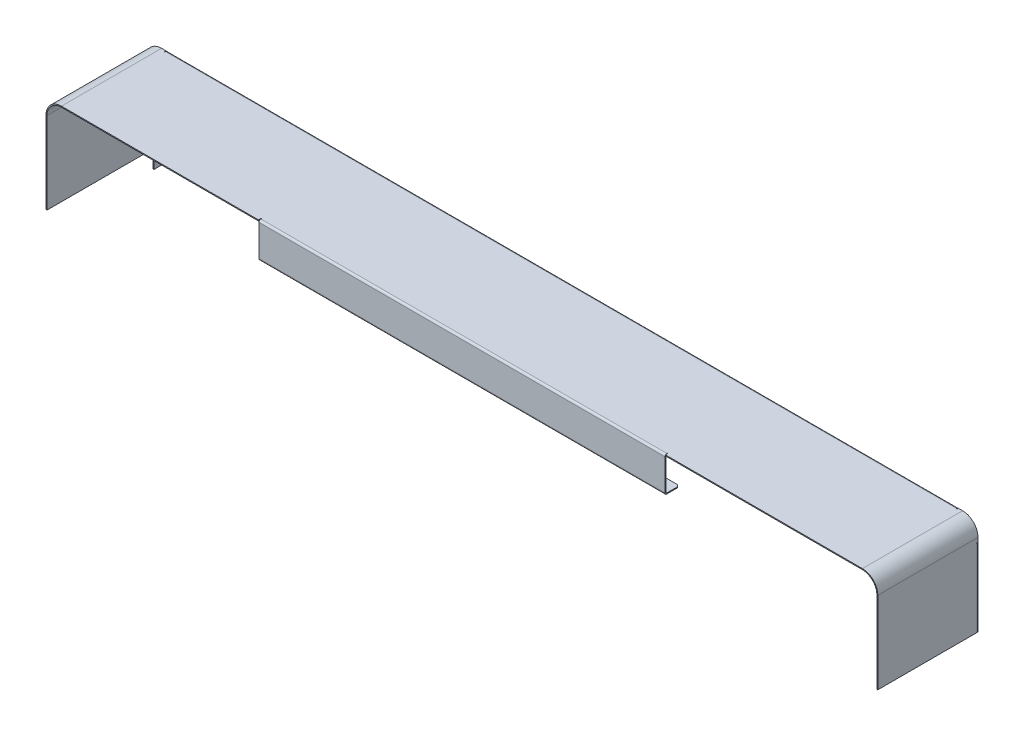
from build123d import *

# Parameters (mm, degrees)
BASE_FLANGE1_DEPTH             = 104
EDGE_FLANGE1_STRIP_W           = 6
EDGE_FLANGE1_STRIP_H           = 1
EDGE_FLANGE1_STRIP_CUT_DEPTH   = 821.4
EDGE_FLANGE1_RELIEF_W          = 6.5
EDGE_FLANGE1_RELIEF_H          = 0.5
EDGE_FLANGE1_RELIEF_CUT_DEPTH  = 1
EDGE_FLANGE1_DEPTH             = 821.4
EDGE_FLANGE2_STRIP_W           = 6
EDGE_FLANGE2_STRIP_H           = 1
EDGE_FLANGE2_STRIP_CUT_DEPTH   = 821.4
EDGE_FLANGE2_DEPTH             = 821.4
EDGE_FLANGE3_STRIP_W           = 6
EDGE_FLANGE3_STRIP_H           = 1
EDGE_FLANGE3_STRIP_CUT_DEPTH   = 80
EDGE_FLANGE3_RELIEF_W          = 6.5
EDGE_FLANGE3_RELIEF_H          = 0.5
EDGE_FLANGE3_RELIEF_CUT_DEPTH  = 1
EDGE_FLANGE3_DEPTH             = 80
EDGE_FLANGE4_STRIP_W           = 6
EDGE_FLANGE4_STRIP_H           = 1
EDGE_FLANGE4_STRIP_CUT_DEPTH   = 80
EDGE_FLANGE4_DEPTH             = 80
EDGE_FLANGE5_STRIP_W           = 6
EDGE_FLANGE5_STRIP_H           = 1
EDGE_FLANGE5_STRIP_CUT_DEPTH   = 421.4
EDGE_FLANGE5_RELIEF_W          = 6.5
EDGE_FLANGE5_RELIEF_H          = 0.5
EDGE_FLANGE5_RELIEF_CUT_DEPTH  = 1
EDGE_FLANGE5_DEPTH             = 421.4
SKETCH22_R                     = 2.5
CUT_EXTRUDE1_DEPTH             = 1
SKETCH23_R                     = 2.5
CUT_EXTRUDE2_DEPTH             = 3
CUT_EXTRUDE2_DIRECTION_2_REACH = 857.652
EDGE_FLANGE6_STRIP_W           = 6
EDGE_FLANGE6_STRIP_H           = 1
EDGE_FLANGE6_STRIP_CUT_DEPTH   = 421.4
EDGE_FLANGE6_DEPTH             = 421.4
EDGE_FLANGE6_FLAT_DEPTH        = 1


# Sheet-metal steps are written as plain solids
with BuildPart() as part:
    # Sketch1 → Base-Flange1 (new body)
    with BuildSketch(Plane.XY):
        with BuildLine():
            Line((-430.7, -100), (-430.7, -15))
            ThreePointArc((-430.7, -15), (-426.306601718, -4.393398282), (-415.7, 0))
            Line((-415.7, 0), (415.7, 0))
            ThreePointArc((415.7, 0), (426.306601718, -4.393398282), (430.7, -15))
            Line((430.7, -15), (430.7, -100))
            Line((430.7, -100), (431.7, -100))
            Line((431.7, -100), (431.7, -15))
            ThreePointArc((431.7, -15), (427.013708499, -3.686291501), (415.7, 1))
            Line((415.7, 1), (-415.7, 1))
            ThreePointArc((-415.7, 1), (-427.013708499, -3.686291501), (-431.7, -15))
            Line((-431.7, -15), (-431.7, -100))
            Line((-431.7, -100), (-430.7, -100))
        make_face()
    extrude(amount=BASE_FLANGE1_DEPTH)

    # Edge-Flange1 strip (across the edge) → Edge-Flange1 strip cut (cut)
    with BuildSketch(Plane(origin=(-410.7, 0, 0), x_dir=(0, 0, 1), z_dir=(1, 0, 0))):
        with Locations((-2, -0.5)):
            Rectangle(EDGE_FLANGE1_STRIP_W, EDGE_FLANGE1_STRIP_H)
    extrude(amount=EDGE_FLANGE1_STRIP_CUT_DEPTH, mode=Mode.SUBTRACT)

    # Edge-Flange1 relief (on the sheet) → Edge-Flange1 relief cut (cut)
    with BuildSketch(Plane(origin=(-410.7, 0, 1), x_dir=(0, 0, 1), z_dir=(0, -1, 0))):
        with Locations((-2.75, 0.25)):
            Rectangle(EDGE_FLANGE1_RELIEF_W, EDGE_FLANGE1_RELIEF_H)
        with Locations((-2.75, -821.65)):
            Rectangle(EDGE_FLANGE1_RELIEF_W, EDGE_FLANGE1_RELIEF_H)
    extrude(amount=-EDGE_FLANGE1_RELIEF_CUT_DEPTH, mode=Mode.SUBTRACT)

    # Edge-Flange1 section (across the edge) → Edge-Flange1 (add)
    with BuildSketch(Plane(origin=(-410.7, 0, 0), x_dir=(0, 0, 1), z_dir=(1, 0, 0))):
        with BuildLine():
            Line((-1, 1), (-1, 19))
            Line((-1, 19), (0, 19))
            Line((0, 19), (0, 1))
            ThreePointArc((0, 1), (0.292893219, 0.292893219), (1, 0))
            Line((1, 0), (1, -1))
            ThreePointArc((1, -1), (-0.414213562, -0.414213562), (-1, 1))
        make_face()
    extrude(amount=EDGE_FLANGE1_DEPTH)

    # Edge-Flange2 strip (across the edge) → Edge-Flange2 strip cut (cut)
    with BuildSketch(Plane(origin=(-410.7, -19, 0), x_dir=(0, 1, 0), z_dir=(1, 0, 0))):
        with Locations((-1, -0.5)):
            Rectangle(EDGE_FLANGE2_STRIP_W, EDGE_FLANGE2_STRIP_H)
    extrude(amount=EDGE_FLANGE2_STRIP_CUT_DEPTH, mode=Mode.SUBTRACT)

    # Edge-Flange2 section (across the edge) → Edge-Flange2 (add)
    with BuildSketch(Plane(origin=(-410.7, -19, 0), x_dir=(0, 1, 0), z_dir=(1, 0, 0))):
        with BuildLine():
            Line((0, 1), (0, 12))
            Line((0, 12), (1, 12))
            Line((1, 12), (1, 1))
            ThreePointArc((1, 1), (1.292893219, 0.292893219), (2, 0))
            Line((2, 0), (2, -1))
            ThreePointArc((2, -1), (0.585786438, -0.414213562), (0, 1))
        make_face()
    extrude(amount=EDGE_FLANGE2_DEPTH)

    # Edge-Flange3 strip (across the edge) → Edge-Flange3 strip cut (cut)
    with BuildSketch(Plane(origin=(-430.7, -100, 0), x_dir=(0, 0, 1), z_dir=(0, 1, 0))):
        with Locations((-2, -0.5)):
            Rectangle(EDGE_FLANGE3_STRIP_W, EDGE_FLANGE3_STRIP_H)
    edge_flange3_strip_cut = extrude(amount=EDGE_FLANGE3_STRIP_CUT_DEPTH, mode=Mode.SUBTRACT)

    # Edge-Flange3 relief (on the sheet) → Edge-Flange3 relief cut (cut)
    with BuildSketch(Plane(origin=(-430.7, -100, 1), x_dir=(0, 0, 1), z_dir=(1, 0, 0))):
        with Locations((-2.75, -80.25)):
            Rectangle(EDGE_FLANGE3_RELIEF_W, EDGE_FLANGE3_RELIEF_H)
    edge_flange3_relief_cut = extrude(amount=-EDGE_FLANGE3_RELIEF_CUT_DEPTH, mode=Mode.SUBTRACT)

    # Edge-Flange3 section (across the edge) → Edge-Flange3 (add)
    with BuildSketch(Plane(origin=(-430.7, -100, 0), x_dir=(0, 0, 1), z_dir=(0, 1, 0))):
        with BuildLine():
            Line((-1, 1), (-1, 19))
            Line((-1, 19), (0, 19))
            Line((0, 19), (0, 1))
            ThreePointArc((0, 1), (0.292893219, 0.292893219), (1, 0))
            Line((1, 0), (1, -1))
            ThreePointArc((1, -1), (-0.414213562, -0.414213562), (-1, 1))
        make_face()
    edge_flange3 = extrude(amount=EDGE_FLANGE3_DEPTH)

    # Edge-Flange4 strip (across the edge) → Edge-Flange4 strip cut (cut)
    with BuildSketch(Plane(origin=(-411.7, -100, 0), x_dir=(-1, 0, 0), z_dir=(0, 1, 0))):
        with Locations((-1, -0.5)):
            Rectangle(EDGE_FLANGE4_STRIP_W, EDGE_FLANGE4_STRIP_H)
    edge_flange4_strip_cut = extrude(amount=EDGE_FLANGE4_STRIP_CUT_DEPTH, mode=Mode.SUBTRACT)

    # Edge-Flange4 section (across the edge) → Edge-Flange4 (add)
    with BuildSketch(Plane(origin=(-411.7, -100, 0), x_dir=(-1, 0, 0), z_dir=(0, 1, 0))):
        with BuildLine():
            Line((0, 1), (0, 12))
            Line((0, 12), (1, 12))
            Line((1, 12), (1, 1))
            ThreePointArc((1, 1), (1.292893219, 0.292893219), (2, 0))
            Line((2, 0), (2, -1))
            ThreePointArc((2, -1), (0.585786438, -0.414213562), (0, 1))
        make_face()
    edge_flange4 = extrude(amount=EDGE_FLANGE4_DEPTH)

    # Mirror1: Edge-Flange3 strip cut, Edge-Flange3 relief cut, Edge-Flange3, Edge-Flange4 strip cut, Edge-Flange4 across plane
    add(edge_flange3_strip_cut.mirror(Plane(origin=(0, 0, 0), x_dir=(0, 0, 1), z_dir=(1, 0, 0))), mode=Mode.SUBTRACT)
    add(edge_flange3_relief_cut.mirror(Plane(origin=(0, 0, 0), x_dir=(0, 0, 1), z_dir=(1, 0, 0))), mode=Mode.SUBTRACT)
    add(edge_flange3.mirror(Plane(origin=(0, 0, 0), x_dir=(0, 0, 1), z_dir=(1, 0, 0))))
    add(edge_flange4_strip_cut.mirror(Plane(origin=(0, 0, 0), x_dir=(0, 0, 1), z_dir=(1, 0, 0))), mode=Mode.SUBTRACT)
    add(edge_flange4.mirror(Plane(origin=(0, 0, 0), x_dir=(0, 0, 1), z_dir=(1, 0, 0))))

    # Edge-Flange5 strip (across the edge) → Edge-Flange5 strip cut (cut)
    with BuildSketch(Plane(origin=(210.7, 0, 104), x_dir=(0, 0, -1), z_dir=(-1, 0, 0))):
        with Locations((-1, -0.5)):
            Rectangle(EDGE_FLANGE5_STRIP_W, EDGE_FLANGE5_STRIP_H)
    extrude(amount=EDGE_FLANGE5_STRIP_CUT_DEPTH, mode=Mode.SUBTRACT)

    # Edge-Flange5 relief (on the sheet) → Edge-Flange5 relief cut (cut)
    with BuildSketch(Plane(origin=(210.7, 0, 102), x_dir=(0, 0, -1), z_dir=(0, -1, 0))):
        with Locations((-2.75, 0.25)):
            Rectangle(EDGE_FLANGE5_RELIEF_W, EDGE_FLANGE5_RELIEF_H)
        with Locations((-2.75, -421.65)):
            Rectangle(EDGE_FLANGE5_RELIEF_W, EDGE_FLANGE5_RELIEF_H)
    extrude(amount=-EDGE_FLANGE5_RELIEF_CUT_DEPTH, mode=Mode.SUBTRACT)

    # Edge-Flange5 section (across the edge) → Edge-Flange5 (add)
    with BuildSketch(Plane(origin=(210.7, 0, 104), x_dir=(0, 0, -1), z_dir=(-1, 0, 0))):
        with BuildLine():
            Line((0, 1), (0, 35.5))
            Line((0, 35.5), (1, 35.5))
            Line((1, 35.5), (1, 1))
            ThreePointArc((1, 1), (1.292893219, 0.292893219), (2, 0))
            Line((2, 0), (2, -1))
            ThreePointArc((2, -1), (0.585786438, -0.414213562), (0, 1))
        make_face()
    extrude(amount=EDGE_FLANGE5_DEPTH)

    # Sketch22 → Cut-Extrude1 (cut)
    with BuildSketch(Plane.XZ.offset(19)):
        with Locations(Location((-349.7, 6, 0), (0, 0, 270))):
            Circle(SKETCH22_R)
        with Locations(Location((-169.7, 6, 0), (0, 0, 270))):
            Circle(SKETCH22_R)
        with Locations(Location((10.3, 6, 0), (0, 0, 270))):
            Circle(SKETCH22_R)
        with Locations(Location((190.3, 6, 0), (0, 0, 270))):
            Circle(SKETCH22_R)
        with Locations(Location((370.3, 6, 0), (0, 0, 270))):
            Circle(SKETCH22_R)
        with Locations((550.3, 6)):
            Circle(SKETCH22_R)
        with Locations((730.3, 6)):
            Circle(SKETCH22_R)
    extrude(amount=-CUT_EXTRUDE1_DEPTH, mode=Mode.SUBTRACT)

    # Sketch23 → Cut-Extrude2 (cut)
    with BuildSketch(Plane.ZY.offset(-411.7)):
        with Locations(Location((6, -68, 0), (0, 0, 180))):
            Circle(SKETCH23_R)
    extrude(amount=-CUT_EXTRUDE2_DEPTH, mode=Mode.SUBTRACT)

    # Cut-Extrude2 direction 2: up to this face of the body (flat: up to its plane)
    cut_extrude2_direction_2_end = Plane(part.part.faces().sort_by_distance((-412.7, -60, 6.5))[0])
    # Sketch23 → Cut-Extrude2 direction 2 (cut, up to the picked face)
    with BuildSketch(Plane.ZY.offset(-411.7), mode=Mode.PRIVATE) as cut_extrude2_direction_2_sk1:
        with Locations(Location((6, -68, 0), (0, 0, 180))):
            Circle(SKETCH23_R)
    cut_extrude2_direction_2_tool1 = split(extrude(cut_extrude2_direction_2_sk1.sketch, amount=CUT_EXTRUDE2_DIRECTION_2_REACH, mode=Mode.PRIVATE), bisect_by=cut_extrude2_direction_2_end, keep=Keep.BOTH, mode=Mode.PRIVATE)
    add(cut_extrude2_direction_2_tool1.solids().sort_by(Axis((411.7, -68, 6), (-1, 0, 0)))[0], mode=Mode.SUBTRACT)

    # Edge-Flange6 strip (across the edge) → Edge-Flange6 strip cut (cut)
    with BuildSketch(Plane(origin=(210.7, -35.5, 103), x_dir=(0, 1, 0), z_dir=(-1, 0, 0))):
        with Locations((-1, -0.5)):
            Rectangle(EDGE_FLANGE6_STRIP_W, EDGE_FLANGE6_STRIP_H)
    extrude(amount=EDGE_FLANGE6_STRIP_CUT_DEPTH, mode=Mode.SUBTRACT)

    # Edge-Flange6 bend section (across the edge) → Edge-Flange6 (add)
    with BuildSketch(Plane(origin=(210.7, -35.5, 103), x_dir=(0, 1, 0), z_dir=(-1, 0, 0))):
        with BuildLine():
            Line((0, 1), (1, 1))
            ThreePointArc((1, 1), (1.292893219, 0.292893219), (2, 0))
            Line((2, 0), (2, -1))
            ThreePointArc((2, -1), (0.585786438, -0.414213562), (0, 1))
        make_face()
    extrude(amount=EDGE_FLANGE6_DEPTH)

    # Edge-Flange6 profile (on flange) → Edge-Flange6 flat (add)
    with BuildSketch(Plane(origin=(0, -35.5, 103), x_dir=(1, 0, 0), z_dir=(0, 1, 0))):
        with BuildLine():
            Line((-210.7, 1), (210.7, 1))
            Line((210.7, 1), (210.7, 11))
            ThreePointArc((210.7, 11), (209.821320344, 13.121320344), (207.7, 14))
            Line((207.7, 14), (-207.7, 14))
            ThreePointArc((-207.7, 14), (-209.821320344, 13.121320344), (-210.7, 11))
            Line((-210.7, 11), (-210.7, 1))
        make_face()
    extrude(amount=EDGE_FLANGE6_FLAT_DEPTH)


solid = part.part
